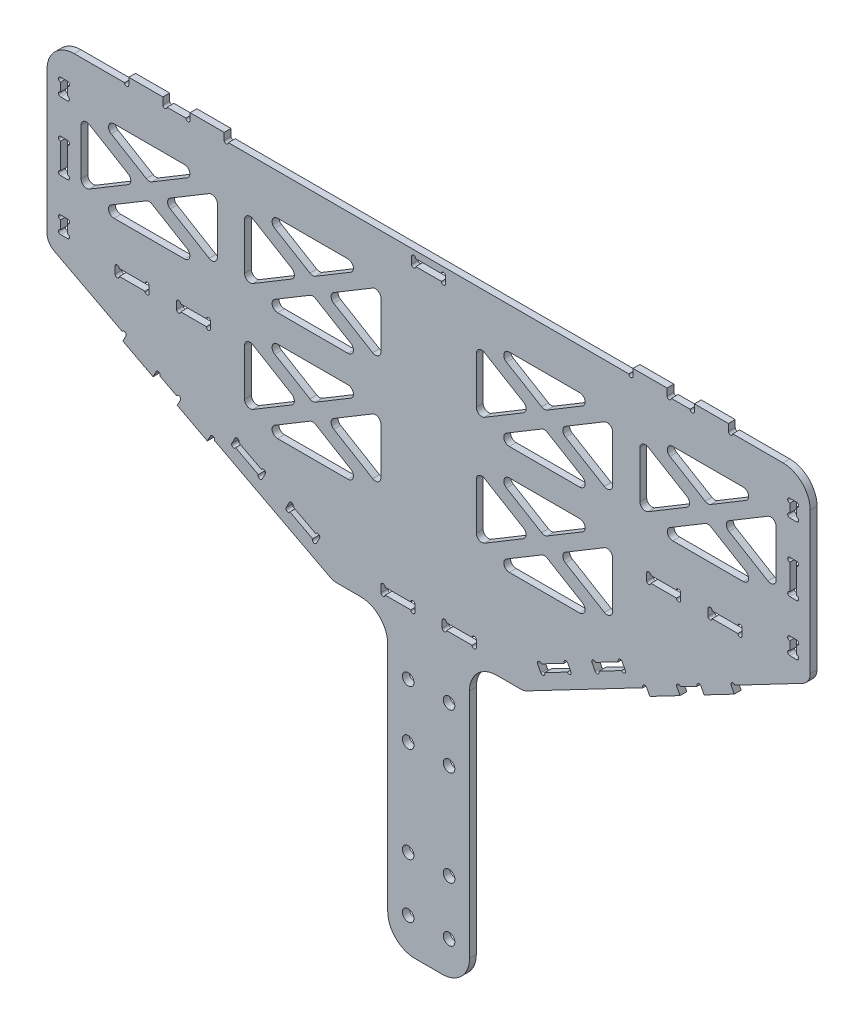
from build123d import *

# Parameters (mm, degrees)
EXTRUDE_1_DEPTH                = 5
SKETCH_2_R                     = 4.25
CUT_EXTRUDE_1_DEPTH            = 26
FILLET_1_R                     = 20
SKETCH_3_W                     = 80.881633881
SKETCH_3_H                     = 35.81900929
EXTRUDE_2_DEPTH                = 5
CUT_EXTRUDE_8_DEPTH            = 5
FILLET_3_R                     = 4
PATTERN_LINEAR_1_COUNT         = 2
PATTERN_LINEAR_1_PITCH         = 80
PATTERN_LINEAR_1_COUNT_DIR2    = 2
PATTERN_LINEAR_1_PITCH_DIR2    = 120
FILLET_3_OF_PATTERN_LINEAR_1_R = 4
MIRROR_1_DEPTH                 = 5
CUT_EXTRUDE_9_DEPTH            = 10
CUT_EXTRUDE_10_DEPTH           = 10
FILLET_4_R                     = 10
SKETCH_13_W                    = 25
SKETCH_13_H                    = 5
CUT_EXTRUDE_11_DEPTH           = 10
SKETCH_14_R                    = 1.55
CUT_EXTRUDE_12_DEPTH           = 10
SKETCH_15_W                    = 5
SKETCH_15_H                    = 12.5
SKETCH_15_H_2                  = 25
CUT_EXTRUDE_13_DEPTH           = 10
SKETCH_16_R                    = 1.55
CUT_EXTRUDE_14_DEPTH           = 10
CUT_EXTRUDE_15_DEPTH           = 10
SKETCH_18_W                    = 25
SKETCH_18_H                    = 5
EXTRUDE_3_DEPTH                = 5
SKETCH_19_R                    = 1.55
CUT_EXTRUDE_16_DEPTH           = 5
EXTRUDE_4_DEPTH                = 5
SKETCH_21_R                    = 1.55
CUT_EXTRUDE_17_DEPTH           = 5


# Read off the part's stored shape, not the designer's step: 镜向1
with BuildPart() as part:
    # 草图1 → 凸台-拉伸1 (new body)
    with BuildSketch(Plane.XY):
        Polygon((-30, 0), (30, 0), (30, 210), (280, 210), (280, 450), (-280, 450), (-280, 210), (-30, 210), align=None)
    extrude(amount=EXTRUDE_1_DEPTH)

    # 草图2 → 切除-拉伸1 (cut)
    with BuildSketch(Plane.XY.offset(5)):
        with Locations((15, 25)):
            Circle(SKETCH_2_R)
        with Locations((15, 65)):
            Circle(SKETCH_2_R)
        with Locations((15, 135)):
            Circle(SKETCH_2_R)
        with Locations((15, 175)):
            Circle(SKETCH_2_R)
        with Locations(Location((-15, 175, 0), (0, 0, 180))):
            Circle(SKETCH_2_R)
        with Locations(Location((-15, 135, 0), (0, 0, 180))):
            Circle(SKETCH_2_R)
        with Locations(Location((-15, 65, 0), (0, 0, 180))):
            Circle(SKETCH_2_R)
        with Locations(Location((-15, 25, 0), (0, 0, 180))):
            Circle(SKETCH_2_R)
    extrude(amount=-CUT_EXTRUDE_1_DEPTH, mode=Mode.SUBTRACT)

    # 圆角1
    fillet_1_edges = [part.edges().sort_by_distance(p)[0] for p in [
        (30, 0, 2.5),
        (-30, 0, 2.5),
        (-30, 210, 2.5),
        (-280, 210, 2.5),
        (-280, 450, 2.5),
        (280, 450, 2.5),
        (280, 210, 2.5),
        (30, 210, 2.5),
    ]]
    fillet(fillet_1_edges, radius=FILLET_1_R)

    # 草图3 → 凸台-拉伸2 (add)
    with BuildSketch(Plane.XY.offset(5)):
        with Locations((-108.227329146, 265.055666303)):
            Rectangle(SKETCH_3_W, SKETCH_3_H)
    extrude(amount=-EXTRUDE_2_DEPTH)

    # 草图10 → 切除-拉伸8 (cut)
    with BuildSketch(Plane.XY.offset(5)):
        Polygon((-245.281746842, 420), (-164.718253158, 420), (-205, 395.830951895), align=None)
        Polygon((-255, 414.169048105), (-255, 365.830951895), (-214.718253158, 390), align=None)
        Polygon((-245.281746842, 360), (-164.718253158, 360), (-205, 384.169048105), align=None)
        Polygon((-155, 414.169048105), (-155, 365.830951895), (-195.281746842, 390), align=None)
    cut_extrude_8 = extrude(amount=-CUT_EXTRUDE_8_DEPTH, mode=Mode.SUBTRACT)

    # 圆角3
    fillet_3_edges = [part.edges().sort_by_distance(p)[0] for p in [
        (-164.718253158, 360, 2.5),
        (-205, 384.169048105, 2.5),
        (-245.281746842, 360, 2.5),
        (-255, 365.830951895, 2.5),
        (-214.718253158, 390, 2.5),
        (-255, 414.169048105, 2.5),
        (-155, 414.169048105, 2.5),
        (-195.281746842, 390, 2.5),
        (-155, 365.830951895, 2.5),
        (-164.718253158, 420, 2.5),
        (-245.281746842, 420, 2.5),
        (-205, 395.830951895, 2.5),
    ]]
    fillet(fillet_3_edges, radius=FILLET_3_R)

    # 阵列(线性)1: Cut-Extrude 8 2 × 2, 1 skipped
    with Locations(*[(j * PATTERN_LINEAR_1_PITCH_DIR2, -i * PATTERN_LINEAR_1_PITCH, 0) for i in range(PATTERN_LINEAR_1_COUNT) for j in range(PATTERN_LINEAR_1_COUNT_DIR2) if (i, j) not in ((0, 0), (1, 0))]):
        add(cut_extrude_8, mode=Mode.SUBTRACT)

    # 圆角3 of 阵列(线性)1
    fillet_3_of_pattern_linear_1_edges = [part.edges().sort_by_distance(p)[0] for p in [
        (-44.718253158, 360, 2.5),
        (-85, 384.169048105, 2.5),
        (-125.281746842, 360, 2.5),
        (-135, 365.830951895, 2.5),
        (-94.718253158, 390, 2.5),
        (-135, 414.169048105, 2.5),
        (-35, 414.169048105, 2.5),
        (-75.281746842, 390, 2.5),
        (-35, 365.830951895, 2.5),
        (-44.718253158, 420, 2.5),
        (-125.281746842, 420, 2.5),
        (-85, 395.830951895, 2.5),
        (-44.718253158, 280, 2.5),
        (-85, 304.169048105, 2.5),
        (-125.281746842, 280, 2.5),
        (-135, 285.830951895, 2.5),
        (-94.718253158, 310, 2.5),
        (-135, 334.169048105, 2.5),
        (-35, 334.169048105, 2.5),
        (-75.281746842, 310, 2.5),
        (-35, 285.830951895, 2.5),
        (-44.718253158, 340, 2.5),
        (-125.281746842, 340, 2.5),
        (-85, 315.830951895, 2.5),
    ]]
    fillet(fillet_3_of_pattern_linear_1_edges, radius=FILLET_3_OF_PATTERN_LINEAR_1_R)

    # 镜向1 outline → 镜向1 (cut)
    with BuildSketch(Plane.XY):
        with BuildLine():
            Line((59.159522351, 280), (110.840477649, 280))
            ThreePointArc((110.840477649, 280), (114.695337362, 282.932265672), (112.898460671, 287.429971703))
            Line((112.898460671, 287.429971703), (87.057983022, 302.934258292))
            ThreePointArc((87.057983022, 302.934258292), (85, 303.504286589), (82.942016978, 302.934258292))
            Line((82.942016978, 302.934258292), (57.101539329, 287.429971703))
            ThreePointArc((57.101539329, 287.429971703), (55.304662638, 282.932265672), (59.159522351, 280))
        make_face()
        with BuildLine():
            Line((110.840477649, 340), (59.159522351, 340))
            ThreePointArc((59.159522351, 340), (55.304662638, 337.067734328), (57.101539329, 332.570028297))
            Line((57.101539329, 332.570028297), (82.942016978, 317.065741708))
            ThreePointArc((82.942016978, 317.065741708), (85, 316.495713411), (87.057983022, 317.065741708))
            Line((87.057983022, 317.065741708), (112.898460671, 332.570028297))
            ThreePointArc((112.898460671, 332.570028297), (114.695337362, 337.067734328), (110.840477649, 340))
        make_face()
        with BuildLine():
            Line((230.840477649, 420), (179.159522351, 420))
            ThreePointArc((179.159522351, 420), (175.304662638, 417.067734328), (177.101539329, 412.570028297))
            Line((177.101539329, 412.570028297), (202.942016978, 397.065741708))
            ThreePointArc((202.942016978, 397.065741708), (205, 396.495713411), (207.057983022, 397.065741708))
            Line((207.057983022, 397.065741708), (232.898460671, 412.570028297))
            ThreePointArc((232.898460671, 412.570028297), (234.695337362, 417.067734328), (230.840477649, 420))
        make_face()
        with BuildLine():
            Line((110.840477649, 420), (59.159522351, 420))
            ThreePointArc((59.159522351, 420), (55.304662638, 417.067734328), (57.101539329, 412.570028297))
            Line((57.101539329, 412.570028297), (82.942016978, 397.065741708))
            ThreePointArc((82.942016978, 397.065741708), (85, 396.495713411), (87.057983022, 397.065741708))
            Line((87.057983022, 397.065741708), (112.898460671, 412.570028297))
            ThreePointArc((112.898460671, 412.570028297), (114.695337362, 417.067734328), (110.840477649, 420))
        make_face()
        with BuildLine():
            Line((179.159522351, 360), (230.840477649, 360))
            ThreePointArc((230.840477649, 360), (234.695337362, 362.932265672), (232.898460671, 367.429971703))
            Line((232.898460671, 367.429971703), (207.057983022, 382.934258292))
            ThreePointArc((207.057983022, 382.934258292), (205, 383.504286589), (202.942016978, 382.934258292))
            Line((202.942016978, 382.934258292), (177.101539329, 367.429971703))
            ThreePointArc((177.101539329, 367.429971703), (175.304662638, 362.932265672), (179.159522351, 360))
        make_face()
        with BuildLine():
            Line((59.159522351, 360), (110.840477649, 360))
            ThreePointArc((110.840477649, 360), (114.695337362, 362.932265672), (112.898460671, 367.429971703))
            Line((112.898460671, 367.429971703), (87.057983022, 382.934258292))
            ThreePointArc((87.057983022, 382.934258292), (85, 383.504286589), (82.942016978, 382.934258292))
            Line((82.942016978, 382.934258292), (57.101539329, 367.429971703))
            ThreePointArc((57.101539329, 367.429971703), (55.304662638, 362.932265672), (59.159522351, 360))
        make_face()
        with BuildLine():
            Line((161.057983022, 369.465741708), (189.565127337, 386.570028297))
            ThreePointArc((189.565127337, 386.570028297), (191.507144315, 390), (189.565127337, 393.429971703))
            Line((189.565127337, 393.429971703), (161.057983022, 410.534258292))
            ThreePointArc((161.057983022, 410.534258292), (157.02920474, 410.585086216), (155, 407.104286589))
            Line((155, 407.104286589), (155, 372.895713411))
            ThreePointArc((155, 372.895713411), (157.02920474, 369.414913784), (161.057983022, 369.465741708))
        make_face()
        with BuildLine():
            Line((220.434872663, 386.570028297), (248.942016978, 369.465741708))
            ThreePointArc((248.942016978, 369.465741708), (252.97079526, 369.414913784), (255, 372.895713411))
            Line((255, 372.895713411), (255, 407.104286589))
            ThreePointArc((255, 407.104286589), (252.97079526, 410.585086216), (248.942016978, 410.534258292))
            Line((248.942016978, 410.534258292), (220.434872663, 393.429971703))
            ThreePointArc((220.434872663, 393.429971703), (218.492855685, 390), (220.434872663, 386.570028297))
        make_face()
        with BuildLine():
            Line((69.565127337, 313.429971703), (41.057983022, 330.534258292))
            ThreePointArc((41.057983022, 330.534258292), (37.02920474, 330.585086216), (35, 327.104286589))
            Line((35, 327.104286589), (35, 292.895713411))
            ThreePointArc((35, 292.895713411), (37.02920474, 289.414913784), (41.057983022, 289.465741708))
            Line((41.057983022, 289.465741708), (69.565127337, 306.570028297))
            ThreePointArc((69.565127337, 306.570028297), (71.507144315, 310), (69.565127337, 313.429971703))
        make_face()
        with BuildLine():
            Line((128.942016978, 330.534258292), (100.434872663, 313.429971703))
            ThreePointArc((100.434872663, 313.429971703), (98.492855685, 310), (100.434872663, 306.570028297))
            Line((100.434872663, 306.570028297), (128.942016978, 289.465741708))
            ThreePointArc((128.942016978, 289.465741708), (132.97079526, 289.414913784), (135, 292.895713411))
            Line((135, 292.895713411), (135, 327.104286589))
            ThreePointArc((135, 327.104286589), (132.97079526, 330.585086216), (128.942016978, 330.534258292))
        make_face()
        with BuildLine():
            Line((135, 372.895713411), (135, 407.104286589))
            ThreePointArc((135, 407.104286589), (132.97079526, 410.585086216), (128.942016978, 410.534258292))
            Line((128.942016978, 410.534258292), (100.434872663, 393.429971703))
            ThreePointArc((100.434872663, 393.429971703), (98.492855685, 390), (100.434872663, 386.570028297))
            Line((100.434872663, 386.570028297), (128.942016978, 369.465741708))
            ThreePointArc((128.942016978, 369.465741708), (132.97079526, 369.414913784), (135, 372.895713411))
        make_face()
        with BuildLine():
            Line((35, 407.104286589), (35, 372.895713411))
            ThreePointArc((35, 372.895713411), (37.02920474, 369.414913784), (41.057983022, 369.465741708))
            Line((41.057983022, 369.465741708), (69.565127337, 386.570028297))
            ThreePointArc((69.565127337, 386.570028297), (71.507144315, 390), (69.565127337, 393.429971703))
            Line((69.565127337, 393.429971703), (41.057983022, 410.534258292))
            ThreePointArc((41.057983022, 410.534258292), (37.02920474, 410.585086216), (35, 407.104286589))
        make_face()
    extrude(amount=MIRROR_1_DEPTH, mode=Mode.SUBTRACT)

    # 草图11 → 切除-拉伸9 (cut)
    with BuildSketch(Plane.XY.offset(5)):
        with BuildLine():
            Line((-9.4, 445), (9.4, 445))
            ThreePointArc((9.4, 445), (10.95, 446.55), (12.5, 445))
            Line((12.5, 445), (12.5, 440))
            ThreePointArc((12.5, 440), (10.95, 438.45), (9.4, 440))
            Line((9.4, 440), (-9.4, 440))
            ThreePointArc((-9.4, 440), (-10.95, 438.45), (-12.5, 440))
            Line((-12.5, 440), (-12.5, 445))
            ThreePointArc((-12.5, 445), (-10.95, 446.55), (-9.4, 445))
        make_face()
    extrude(amount=-CUT_EXTRUDE_9_DEPTH, mode=Mode.SUBTRACT)

    # 草图12 → 切除-拉伸10 (cut)
    with BuildSketch(Plane.XY.offset(5)):
        with BuildLine():
            Line((-280, 320), (-70, 210))
            Line((-70, 210), (-260, 210))
            ThreePointArc((-260, 210), (-274.142135624, 215.857864376), (-280, 230))
            Line((-280, 230), (-280, 320))
        make_face()
        with BuildLine():
            Line((280, 320), (70, 210))
            Line((70, 210), (260, 210))
            ThreePointArc((260, 210), (274.142135624, 215.857864376), (280, 230))
            Line((280, 230), (280, 320))
        make_face()
    extrude(amount=-CUT_EXTRUDE_10_DEPTH, mode=Mode.SUBTRACT)

    # 圆角4
    fillet_4_edges = [part.edges().sort_by_distance(p)[0] for p in [
        (-280, 320, 2.5),
        (-70, 210, 2.5),
        (280, 320, 2.5),
        (70, 210, 2.5),
    ]]
    fillet(fillet_4_edges, radius=FILLET_4_R)

    # 草图13 → 切除-拉伸11 (cut)
    with BuildSketch(Plane.XY.offset(5)):
        with Locations((172.5, 327.5)):
            Rectangle(SKETCH_13_W, SKETCH_13_H)
        with Locations((217.5, 327.5)):
            Rectangle(SKETCH_13_W, SKETCH_13_H)
        with Locations((-217.5, 327.5)):
            Rectangle(SKETCH_13_W, SKETCH_13_H)
        with Locations((-172.5, 327.5)):
            Rectangle(SKETCH_13_W, SKETCH_13_H)
    extrude(amount=-CUT_EXTRUDE_11_DEPTH, mode=Mode.SUBTRACT)

    # 草图14 → 切除-拉伸12 (cut)
    with BuildSketch(Plane.XY.offset(5)):
        with Locations((228.45, 330)):
            Circle(SKETCH_14_R)
        with Locations((206.55, 330)):
            Circle(SKETCH_14_R)
        with Locations((206.55, 325)):
            Circle(SKETCH_14_R)
        with Locations((228.45, 325)):
            Circle(SKETCH_14_R)
        with Locations((183.45, 330)):
            Circle(SKETCH_14_R)
        with Locations((161.55, 330)):
            Circle(SKETCH_14_R)
        with Locations((183.45, 325)):
            Circle(SKETCH_14_R)
        with Locations((161.55, 325)):
            Circle(SKETCH_14_R)
        with Locations((-161.55, 325)):
            Circle(SKETCH_14_R)
        with Locations((-183.45, 325)):
            Circle(SKETCH_14_R)
        with Locations((-161.55, 330)):
            Circle(SKETCH_14_R)
        with Locations((-183.45, 330)):
            Circle(SKETCH_14_R)
        with Locations((-228.45, 325)):
            Circle(SKETCH_14_R)
        with Locations((-206.55, 325)):
            Circle(SKETCH_14_R)
        with Locations((-206.55, 330)):
            Circle(SKETCH_14_R)
        with Locations((-228.45, 330)):
            Circle(SKETCH_14_R)
    extrude(amount=-CUT_EXTRUDE_12_DEPTH, mode=Mode.SUBTRACT)

    # 草图15 → 切除-拉伸13 (cut)
    with BuildSketch(Plane.XY.offset(5)):
        with Locations((-267.5, 423.75)):
            Rectangle(SKETCH_15_W, SKETCH_15_H)
        with Locations((-267.5, 380)):
            Rectangle(SKETCH_15_W, SKETCH_15_H_2)
        with Locations((-267.5, 336.25)):
            Rectangle(SKETCH_15_W, SKETCH_15_H)
        with Locations((267.5, 336.25)):
            Rectangle(SKETCH_15_W, SKETCH_15_H)
        with Locations((267.5, 380)):
            Rectangle(SKETCH_15_W, SKETCH_15_H_2)
        with Locations((267.5, 423.75)):
            Rectangle(SKETCH_15_W, SKETCH_15_H)
    extrude(amount=-CUT_EXTRUDE_13_DEPTH, mode=Mode.SUBTRACT)

    # 草图16 → 切除-拉伸14 (cut)
    with BuildSketch(Plane.XY.offset(5)):
        with Locations((-265, 428.45)):
            Circle(SKETCH_16_R)
        with Locations((-265, 419.05)):
            Circle(SKETCH_16_R)
        with Locations((-270, 428.45)):
            Circle(SKETCH_16_R)
        with Locations((-270, 419.05)):
            Circle(SKETCH_16_R)
        with Locations((-265, 390.95)):
            Circle(SKETCH_16_R)
        with Locations((-265, 369.05)):
            Circle(SKETCH_16_R)
        with Locations((-270, 390.95)):
            Circle(SKETCH_16_R)
        with Locations((-270, 369.05)):
            Circle(SKETCH_16_R)
        with Locations((-265, 340.95)):
            Circle(SKETCH_16_R)
        with Locations((-265, 331.55)):
            Circle(SKETCH_16_R)
        with Locations((-270, 340.95)):
            Circle(SKETCH_16_R)
        with Locations((-270, 331.55)):
            Circle(SKETCH_16_R)
        with Locations((270, 331.55)):
            Circle(SKETCH_16_R)
        with Locations((270, 340.95)):
            Circle(SKETCH_16_R)
        with Locations((265, 331.55)):
            Circle(SKETCH_16_R)
        with Locations((265, 340.95)):
            Circle(SKETCH_16_R)
        with Locations((270, 369.05)):
            Circle(SKETCH_16_R)
        with Locations((270, 390.95)):
            Circle(SKETCH_16_R)
        with Locations((265, 369.05)):
            Circle(SKETCH_16_R)
        with Locations((265, 390.95)):
            Circle(SKETCH_16_R)
        with Locations((270, 419.05)):
            Circle(SKETCH_16_R)
        with Locations((270, 428.45)):
            Circle(SKETCH_16_R)
        with Locations((265, 419.05)):
            Circle(SKETCH_16_R)
        with Locations((265, 428.45)):
            Circle(SKETCH_16_R)
    extrude(amount=-CUT_EXTRUDE_14_DEPTH, mode=Mode.SUBTRACT)

    # 草图17 → 切除-拉伸15 (cut)
    with BuildSketch(Plane.XY.offset(5)):
        with BuildLine():
            Line((-142.00820747, 264.651827138), (-144.328242443, 260.222669462))
            ThreePointArc((-144.328242443, 260.222669462), (-143.674414405, 258.13041974), (-141.582164684, 258.784247778))
            Line((-141.582164684, 258.784247778), (-124.92853182, 250.060916278))
            ThreePointArc((-124.92853182, 250.060916278), (-124.274703782, 247.968666557), (-122.182454061, 248.622494595))
            Line((-122.182454061, 248.622494595), (-119.862419088, 253.051652271))
            ThreePointArc((-119.862419088, 253.051652271), (-120.516247126, 255.143901993), (-122.608496847, 254.490073955))
            Line((-122.608496847, 254.490073955), (-139.26212971, 263.213405455))
            ThreePointArc((-139.26212971, 263.213405455), (-139.915957748, 265.305655176), (-142.00820747, 264.651827138))
        make_face()
        with BuildLine():
            Line((-102.145788382, 243.771512378), (-104.465823355, 239.342354702))
            ThreePointArc((-104.465823355, 239.342354702), (-103.811995317, 237.25010498), (-101.719745596, 237.903933018))
            Line((-101.719745596, 237.903933018), (-85.066112733, 229.180601518))
            ThreePointArc((-85.066112733, 229.180601518), (-84.412284695, 227.088351797), (-82.320034973, 227.742179835))
            Line((-82.320034973, 227.742179835), (-80, 232.171337511))
            ThreePointArc((-80, 232.171337511), (-80.653828038, 234.263587233), (-82.746077759, 233.609759195))
            Line((-82.746077759, 233.609759195), (-99.399710623, 242.333090694))
            ThreePointArc((-99.399710623, 242.333090694), (-100.053538661, 244.425340416), (-102.145788382, 243.771512378))
        make_face()
        with BuildLine():
            Line((-35, 225), (-35, 220))
            ThreePointArc((-35, 220), (-33.45, 218.45), (-31.9, 220))
            Line((-31.9, 220), (-13.1, 220))
            ThreePointArc((-13.1, 220), (-11.55, 218.45), (-10, 220))
            Line((-10, 220), (-10, 225))
            ThreePointArc((-10, 225), (-11.55, 226.55), (-13.1, 225))
            Line((-13.1, 225), (-31.9, 225))
            ThreePointArc((-31.9, 225), (-33.45, 226.55), (-35, 225))
        make_face()
        with BuildLine():
            Line((13.1, 225), (31.9, 225))
            ThreePointArc((31.9, 225), (33.45, 226.55), (35, 225))
            Line((35, 225), (35, 220))
            ThreePointArc((35, 220), (33.45, 218.45), (31.9, 220))
            Line((31.9, 220), (13.1, 220))
            ThreePointArc((13.1, 220), (11.55, 218.45), (10, 220))
            Line((10, 220), (10, 225))
            ThreePointArc((10, 225), (11.55, 226.55), (13.1, 225))
        make_face()
        with BuildLine():
            Line((82.746077759, 233.609759195), (99.399710623, 242.333090694))
            ThreePointArc((99.399710623, 242.333090694), (100.053538661, 244.425340416), (102.145788382, 243.771512378))
            Line((102.145788382, 243.771512378), (104.465823355, 239.342354702))
            ThreePointArc((104.465823355, 239.342354702), (103.811995317, 237.25010498), (101.719745596, 237.903933018))
            Line((101.719745596, 237.903933018), (85.066112733, 229.180601518))
            ThreePointArc((85.066112733, 229.180601518), (84.412284695, 227.088351797), (82.320034973, 227.742179835))
            Line((82.320034973, 227.742179835), (80, 232.171337511))
            ThreePointArc((80, 232.171337511), (80.653828038, 234.263587233), (82.746077759, 233.609759195))
        make_face()
        with BuildLine():
            Line((122.608496847, 254.490073955), (139.26212971, 263.213405455))
            ThreePointArc((139.26212971, 263.213405455), (139.915957748, 265.305655176), (142.00820747, 264.651827138))
            Line((142.00820747, 264.651827138), (144.328242443, 260.222669462))
            ThreePointArc((144.328242443, 260.222669462), (143.674414405, 258.13041974), (141.582164684, 258.784247778))
            Line((141.582164684, 258.784247778), (124.92853182, 250.060916278))
            ThreePointArc((124.92853182, 250.060916278), (124.274703782, 247.968666557), (122.182454061, 248.622494595))
            Line((122.182454061, 248.622494595), (119.862419088, 253.051652271))
            ThreePointArc((119.862419088, 253.051652271), (120.516247126, 255.143901993), (122.608496847, 254.490073955))
        make_face()
    extrude(amount=-CUT_EXTRUDE_15_DEPTH, mode=Mode.SUBTRACT)

    # 草图18 → 凸台-拉伸3 (add)
    with BuildSketch(Plane.XY.offset(5)):
        with Locations((162.5, 452.5)):
            Rectangle(SKETCH_18_W, SKETCH_18_H)
        with Locations((-207.5, 452.5)):
            Rectangle(SKETCH_18_W, SKETCH_18_H)
        with Locations((207.5, 452.5)):
            Rectangle(SKETCH_18_W, SKETCH_18_H)
        with Locations((-162.5, 452.5)):
            Rectangle(SKETCH_18_W, SKETCH_18_H)
    extrude(amount=-EXTRUDE_3_DEPTH)

    # 草图19 → 切除-拉伸16 (cut)
    with BuildSketch(Plane.XY.offset(5)):
        with Locations((148.45, 450)):
            Circle(SKETCH_19_R)
        with Locations((176.55, 450)):
            Circle(SKETCH_19_R)
        with Locations((193.45, 450)):
            Circle(SKETCH_19_R)
        with Locations((221.55, 450)):
            Circle(SKETCH_19_R)
        with Locations((-221.55, 450)):
            Circle(SKETCH_19_R)
        with Locations((-193.45, 450)):
            Circle(SKETCH_19_R)
        with Locations((-176.55, 450)):
            Circle(SKETCH_19_R)
        with Locations((-148.45, 450)):
            Circle(SKETCH_19_R)
    extrude(amount=-CUT_EXTRUDE_16_DEPTH, mode=Mode.SUBTRACT)

    # 草图20 → 凸台-拉伸4 (add)
    with BuildSketch(Plane.XY.offset(5)):
        Polygon((160, 257.142857143), (162.320034973, 252.713699466), (184.465823355, 264.313874333), (182.145788382, 268.74303201), align=None)
        Polygon((199.862419088, 278.023171903), (202.182454061, 273.594014227), (224.328242443, 285.194189093), (222.00820747, 289.62334677), align=None)
        Polygon((-199.862419088, 278.023171903), (-222.00820747, 289.62334677), (-224.328242443, 285.194189093), (-202.182454061, 273.594014227), align=None)
        Polygon((-160, 257.142857143), (-182.145788382, 268.74303201), (-184.465823355, 264.313874333), (-162.320034973, 252.713699466), align=None)
    extrude(amount=-EXTRUDE_4_DEPTH)

    # 草图21 → 切除-拉伸17 (cut)
    with BuildSketch(Plane.XY.offset(5)):
        with Locations((223.381246349, 290.342557612)):
            Circle(SKETCH_21_R)
        with Locations((198.489380208, 277.303961061)):
            Circle(SKETCH_21_R)
        with Locations((183.518827262, 269.462242851)):
            Circle(SKETCH_21_R)
        with Locations((158.62696112, 256.423646301)):
            Circle(SKETCH_21_R)
        with Locations((-158.62696112, 256.423646301)):
            Circle(SKETCH_21_R)
        with Locations((-183.518827262, 269.462242851)):
            Circle(SKETCH_21_R)
        with Locations((-198.489380208, 277.303961061)):
            Circle(SKETCH_21_R)
        with Locations((-223.381246349, 290.342557612)):
            Circle(SKETCH_21_R)
    extrude(amount=-CUT_EXTRUDE_17_DEPTH, mode=Mode.SUBTRACT)


solid = part.part
